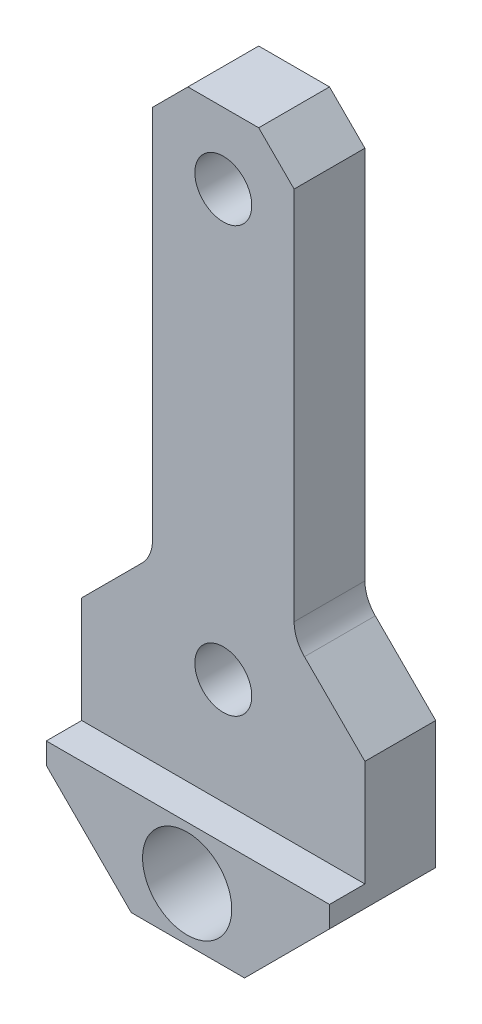
from build123d import *

# Parameters (mm, degrees)
SKETCH1_W                   = 25.4
SKETCH1_H                   = 66.675
BOSS_EXTRUDE1_DEPTH         = 9.525
TAP_DRILL_FOR_1_4_20_TAP1_D = 5.1054
SKETCH4_W                   = 3.175
SKETCH4_H                   = 57.15
CUT_EXTRUDE1_DEPTH          = 64.261426833
F_8_0_8_DIAMETER_HOLE1_D    = 8
CHAMFER1_SIZE               = 7.62
CUT_EXTRUDE2_DEPTH          = 86.959863454
CHAMFER2_SIZE               = 6.35
FILLET1_DEPTH               = 6.35
CHAMFER3_SIZE               = 3.175


with BuildPart() as part:
    # Sketch1 → Boss-Extrude1 (new body)
    with BuildSketch(Plane.XY):
        with Locations((50.8, 23.8125)):
            Rectangle(SKETCH1_W, SKETCH1_H)
    extrude(amount=BOSS_EXTRUDE1_DEPTH)

    # Tap Drill for 1/4-20 Tap1 (through all)
    with Locations(Plane(origin=(0, 0, 0), x_dir=(-1, 0, 0), z_dir=(0, 0, -1))):
        with Locations((-50.8, 47.625), (-50.8, 9.525)):
            Hole(TAP_DRILL_FOR_1_4_20_TAP1_D / 2)

    # Sketch4 → Cut-Extrude1 (cut, through all)
    with BuildSketch(Plane(origin=(63.5, 0, 0), x_dir=(0, 0, -1), z_dir=(1, 0, 0))):
        with Locations((-7.9375, 28.575)):
            Rectangle(SKETCH4_W, SKETCH4_H)
    extrude(amount=-CUT_EXTRUDE1_DEPTH, mode=Mode.SUBTRACT)

    # Ø8.0 (8) Diameter Hole1 (through all)
    with Locations(Plane(origin=(0, 0, 0), x_dir=(-1, 0, 0), z_dir=(0, 0, -1))):
        with Locations((-50.732643015, -4.7625)):
            Hole(F_8_0_8_DIAMETER_HOLE1_D / 2)

    # Chamfer1
    chamfer1_edges = [part.edges().sort_by_distance(p)[0] for p in [
        (63.5, -9.525, 4.7625),
        (38.1, -9.525, 4.7625),
    ]]
    chamfer(chamfer1_edges, length=CHAMFER1_SIZE)

    # Sketch7 → Cut-Extrude2 (cut, through all)
    with BuildSketch(Plane(origin=(0, 0, 0), x_dir=(-1, 0, 0), z_dir=(0, 0, -1))):
        Polygon((-44.45, 15.875), (-21.210032305, 15.875), (-21.210032305, 64.752426372), (-78.308679705, 64.752426372), (-78.308679705, 15.875), (-57.15, 15.875), (-57.15, 53.975), (-44.45, 53.975), align=None)
    extrude(amount=-CUT_EXTRUDE2_DEPTH, mode=Mode.SUBTRACT)

    # Chamfer2
    chamfer2_edges = [part.edges().sort_by_distance(p)[0] for p in [
        (38.1, 15.875, 3.175),
        (63.5, 15.875, 3.175),
    ]]
    chamfer(chamfer2_edges, length=CHAMFER2_SIZE - 0.0001)  # a hair under: the kernel refuses the full size

    # Fillet1: read off the stored shape, not the designer's step
    # Fillet1 outline → Fillet1 (add)
    with BuildSketch(Plane.XY):
        with BuildLine():
            ThreePointArc((44.45, 17.190128061), (44.208317516, 15.975108163), (43.52006403, 14.94506403))
            Line((43.52006403, 14.94506403), (44.45, 15.875))
            Line((44.45, 15.875), (44.45, 17.190128061))
        make_face()
        with BuildLine():
            ThreePointArc((58.07993597, 14.94506403), (57.391682484, 15.975108163), (57.15, 17.190128061))
            Line((57.15, 17.190128061), (57.15, 15.875))
            Line((57.15, 15.875), (58.07993597, 14.94506403))
        make_face()
    extrude(amount=FILLET1_DEPTH)

    # Chamfer3
    chamfer3_edges = [part.edges().sort_by_distance(p)[0] for p in [
        (57.15, 53.975, 3.175),
        (44.45, 53.975, 3.175),
    ]]
    chamfer(chamfer3_edges, length=CHAMFER3_SIZE)


solid = part.part
